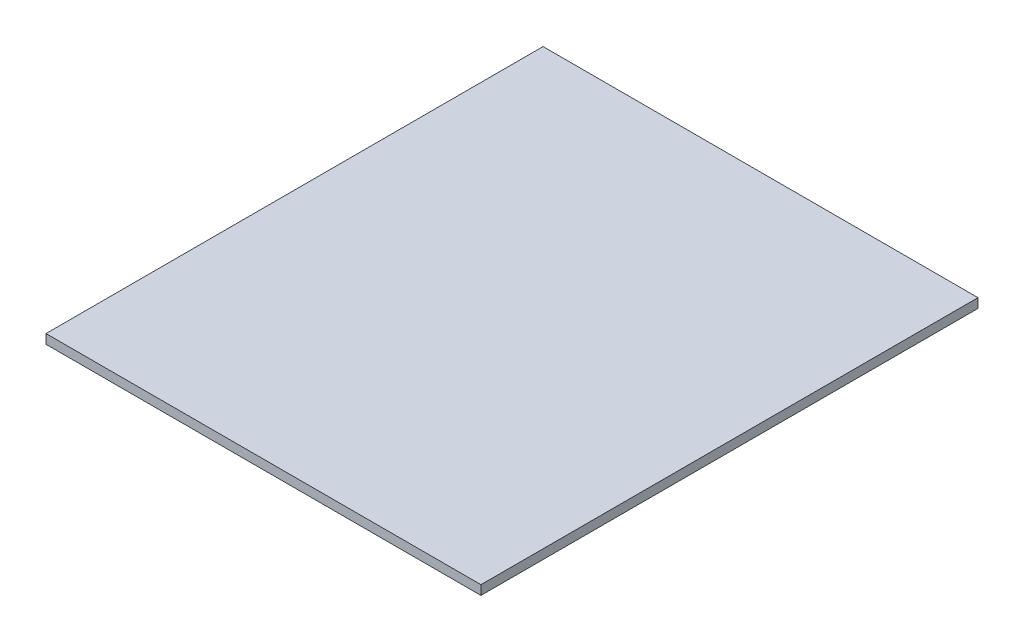
from build123d import *

# Parameters (mm, degrees)
SKETCH1_W           = 533.4
SKETCH1_H           = 609.6
BOSS_EXTRUDE1_DEPTH = 11.4554


with BuildPart() as part:
    # Sketch1 → Boss-Extrude1 (new body)
    with BuildSketch(Plane(origin=(0, 0, 0), x_dir=(1, 0, 0), z_dir=(0, 1, 0))):
        Rectangle(SKETCH1_W, SKETCH1_H)
    extrude(amount=BOSS_EXTRUDE1_DEPTH)


solid = part.part
